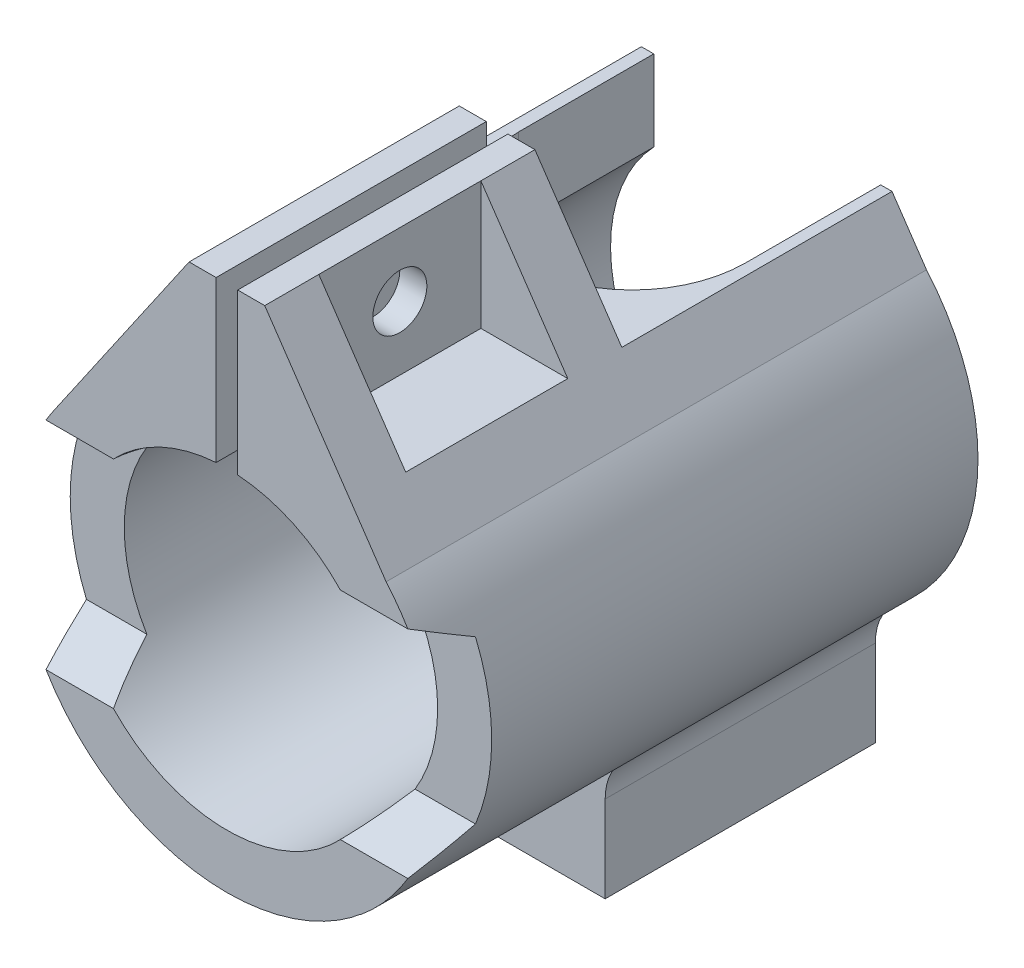
from build123d import *
from build123d.topology import SkipClean

# Parameters (mm, degrees)
BOSS_EXTRUDE1_DEPTH            = 50
SKETCH4_W                      = 15
SKETCH4_H                      = 11.826160891
CUT_EXTRUDE3_DEPTH             = 63.345809803
CUT_EXTRUDE4_DEPTH             = 63.345809803
CUT_EXTRUDE4_DEPTH_BACK        = 63.345809803
SKETCH5_R                      = 2.5
CUT_EXTRUDE8_DEPTH             = 63.345809803
CUT_EXTRUDE8_DEPTH_BACK        = 63.345809803
SKETCH9_W                      = 25
SKETCH9_H                      = 11.826160891
CUT_EXTRUDE9_REACH             = 70.149
CUT_EXTRUDE9_END_RADIUS        = 14.5
CUT_EXTRUDE9_DIRECTION_2_DEPTH = 2.965476
CUT_EXTRUDE10_DEPTH            = 13
CUT_EXTRUDE10_DEPTH_BACK       = 52.424702308
CUT_EXTRUDE11_DEPTH            = 62.141230033
CUT_EXTRUDE11_DEPTH_BACK       = 62.141230033
CUT_EXTRUDE15_REACH            = 80.138
SKETCH14_R                     = 3.375
BOSS_EXTRUDE2_DEPTH            = 2.5
CUT_EXTRUDE17_DEPTH            = 25


with BuildPart() as part:
    # Sketch1 → Boss-Extrude1 (new body)
    with BuildSketch(Plane.XY):
        with BuildLine():
            Line((3.5, 29.291637032), (1, 29.291637032))
            Line((1, 29.291637032), (1, 14.465476141))
            ThreePointArc((1, 14.465476141), (0, -14.5), (-1, 14.465476141))
            Line((-1, 14.465476141), (-1, 29.291637032))
            Line((-1, 29.291637032), (-3.5, 29.291637032))
            Line((-3.5, 29.291637032), (-16.058186159, 11.06275993))
            ThreePointArc((-16.058186159, 11.06275993), (-19.250030671, -3.112285199), (-11.754006256, -15.559348859))
            ThreePointArc((-11.754006256, -15.559348859), (-10.458303194, -17.343308705), (-10, -19.5))
            Line((-10, -19.5), (-10, -27.5))
            Line((-10, -27.5), (10, -27.5))
            Line((10, -27.5), (10, -19.5))
            ThreePointArc((10, -19.5), (10.653934839, -16.938312759), (12.455712019, -15.003507527))
            ThreePointArc((12.455712019, -15.003507527), (19.43475825, -1.593791628), (14.733651913, 12.773781793))
            Line((14.733651913, 12.773781793), (3.5, 29.291637032))
        make_face()
    extrude(amount=-BOSS_EXTRUDE1_DEPTH)

    # Sketch4 → Cut-Extrude3 (cut, through all)
    with BuildSketch(Plane(origin=(3.5, 0, 0), x_dir=(0, 0, -1), z_dir=(1, 0, 0))):
        with Locations((12.5, 23.378556587)):
            Rectangle(SKETCH4_W, SKETCH4_H)
    cut_extrude3 = extrude(amount=CUT_EXTRUDE3_DEPTH, mode=Mode.SUBTRACT)

    # Mirror1: Cut-Extrude3 across plane
    add(cut_extrude3.mirror(Plane(origin=(0, 0, 0), x_dir=(0, 0, 1), z_dir=(1, 0, 0))), mode=Mode.SUBTRACT)

    # Sketch5 → Cut-Extrude4 (cut, two sides: drawn at the far end of the back side and taken through both)
    with BuildSketch(Plane(origin=(3.5, 0, 0), x_dir=(0, 0, -1), z_dir=(1, 0, 0)).offset(-CUT_EXTRUDE4_DEPTH_BACK)):
        with Locations((12.5, 23.378556587)):
            Circle(SKETCH5_R)
    extrude(amount=CUT_EXTRUDE4_DEPTH + CUT_EXTRUDE4_DEPTH_BACK, mode=Mode.SUBTRACT)

    # Sketch9 → Cut-Extrude8 (cut, two sides: drawn at the far end of the back side and taken through both)
    with BuildSketch(Plane(origin=(3.5, 0, 0), x_dir=(0, 0, -1), z_dir=(1, 0, 0)).offset(-CUT_EXTRUDE8_DEPTH_BACK)):
        with Locations((37.5, 23.378556587)):
            Rectangle(SKETCH9_W, SKETCH9_H)
    extrude(amount=CUT_EXTRUDE8_DEPTH + CUT_EXTRUDE8_DEPTH_BACK, mode=Mode.SUBTRACT)

    # Cut-Extrude9: up to this cylinder (the profile starts outside it)
    cut_extrude9_end = Plane(origin=(0, 0, -39.610639), z_dir=(0, 0, 1)) * Cylinder(CUT_EXTRUDE9_END_RADIUS, 170.298, mode=Mode.PRIVATE)
    # Sketch8 → Cut-Extrude9 (cut, up to the surface)
    with BuildSketch(Plane(origin=(0, 14.5, 0), x_dir=(1, 0, 0), z_dir=(0, 1, 0)), mode=Mode.PRIVATE) as cut_extrude9_sk1:
        with BuildLine():
            Line((-10.5, 37.5), (-10.5, 50))
            Line((-10.5, 50), (-1, 50))
            Line((-1, 50), (-1, 27.04772752))
            ThreePointArc((-1, 27.04772752), (-7.770135134, 30.437776554), (-10.5, 37.5))
        make_face()
    cut_extrude9_tool1 = extrude(cut_extrude9_sk1.sketch, amount=-CUT_EXTRUDE9_REACH, mode=Mode.PRIVATE) - cut_extrude9_end
    add(cut_extrude9_tool1.solids().sort_by_distance((-5.457616, 14.5, -39.610639))[0], mode=Mode.SUBTRACT)
    # Sketch8 → Cut-Extrude9 (cut, up to the surface)
    with BuildSketch(Plane(origin=(0, 14.5, 0), x_dir=(1, 0, 0), z_dir=(0, 1, 0)), mode=Mode.PRIVATE) as cut_extrude9_sk2:
        with BuildLine():
            Line((10.5, 50), (10.5, 37.5))
            ThreePointArc((10.5, 37.5), (7.770135134, 30.437776554), (1, 27.04772752))
            Line((1, 27.04772752), (1, 50))
            Line((1, 50), (10.5, 50))
        make_face()
    cut_extrude9_tool2 = extrude(cut_extrude9_sk2.sketch, amount=-CUT_EXTRUDE9_REACH, mode=Mode.PRIVATE) - cut_extrude9_end
    add(cut_extrude9_tool2.solids().sort_by_distance((5.457616, 14.5, -39.610639))[0], mode=Mode.SUBTRACT)

    # Sketch8 → Cut-Extrude9 direction 2 (cut)
    with BuildSketch(Plane(origin=(0, 14.5, 0), x_dir=(1, 0, 0), z_dir=(0, 1, 0))):
        with BuildLine():
            Line((-10.5, 37.5), (-10.5, 50))
            Line((-10.5, 50), (-1, 50))
            Line((-1, 50), (-1, 27.04772752))
            ThreePointArc((-1, 27.04772752), (-7.770135134, 30.437776554), (-10.5, 37.5))
        make_face()
        with BuildLine():
            Line((10.5, 50), (10.5, 37.5))
            ThreePointArc((10.5, 37.5), (7.770135134, 30.437776554), (1, 27.04772752))
            Line((1, 27.04772752), (1, 50))
            Line((1, 50), (10.5, 50))
        make_face()
    extrude(amount=CUT_EXTRUDE9_DIRECTION_2_DEPTH, mode=Mode.SUBTRACT)

    # Sketch10 → Cut-Extrude10 (cut, two sides: drawn at the far end of the back side and taken through both)
    with BuildSketch(Plane.XY.offset(-37.5).offset(-CUT_EXTRUDE10_DEPTH_BACK)):
        with BuildLine():
            Line((-7, -12.698425099), (7, -12.698425099))
            Line((7, -12.698425099), (7, -14.941552797))
            ThreePointArc((7, -14.941552797), (0, -16.5), (-7, -14.941552797))
            Line((-7, -14.941552797), (-7, -12.698425099))
        make_face()
    extrude(amount=CUT_EXTRUDE10_DEPTH + CUT_EXTRUDE10_DEPTH_BACK, mode=Mode.SUBTRACT)

    # Sketch11 → Cut-Extrude11 (cut, two sides: drawn at the far end of the back side and taken through both)
    with BuildSketch(Plane(origin=(0, 0, 0), x_dir=(0, 0, -1), z_dir=(1, 0, 0)).offset(-CUT_EXTRUDE11_DEPTH_BACK)):
        Polygon((5, 7.5), (0, 10), (0, -10), (5, -7.5), (5, 0), align=None)
    extrude(amount=CUT_EXTRUDE11_DEPTH + CUT_EXTRUDE11_DEPTH_BACK, mode=Mode.SUBTRACT)

    # Sketch13 → Cut-Extrude15 (cut, up to next)
    with BuildSketch(Plane.XZ.offset(27.5), mode=Mode.PRIVATE) as cut_extrude15_sk1:
        Polygon((0, -31.084195134), (-5.55625, -34.292097567), (-5.55625, -40.707902433), (0, -43.915804866), (5.55625, -40.707902433), (5.55625, -34.292097567), align=None)
    cut_extrude15_tool1 = extrude(cut_extrude15_sk1.sketch, amount=-CUT_EXTRUDE15_REACH, mode=Mode.PRIVATE) & part.part
    add(cut_extrude15_tool1.solids().sort_by_distance((0, -27.5, -37.5))[0], mode=Mode.SUBTRACT)

    # Sketch14 → Boss-Extrude2 (add)
    with BuildSketch(Plane.XZ.offset(27.5)):
        Polygon((5.55625, -40.707902433), (5.55625, -34.292097567), (0, -31.084195134), (-5.55625, -34.292097567), (-5.55625, -40.707902433), (0, -43.915804866), align=None)
        with Locations((0, -37.5)):
            Circle(SKETCH14_R, mode=Mode.SUBTRACT)
    extrude(amount=-BOSS_EXTRUDE2_DEPTH)

    # Sketch15 → Cut-Extrude17 (cut)
    with SkipClean():  # the faces are left unmerged after this step: merging them gives an invalid solid
        with BuildSketch(Plane.XY):
            with BuildLine():
                Line((-19.5, 0), (-19.5, -27.5))
                Line((-19.5, -27.5), (19.5, -27.5))
                Line((19.5, -27.5), (19.5, 0))
                ThreePointArc((19.5, 0), (0, -19.5), (-19.5, 0))
            make_face()
        extrude(amount=-CUT_EXTRUDE17_DEPTH, mode=Mode.SUBTRACT)


solid = part.part
